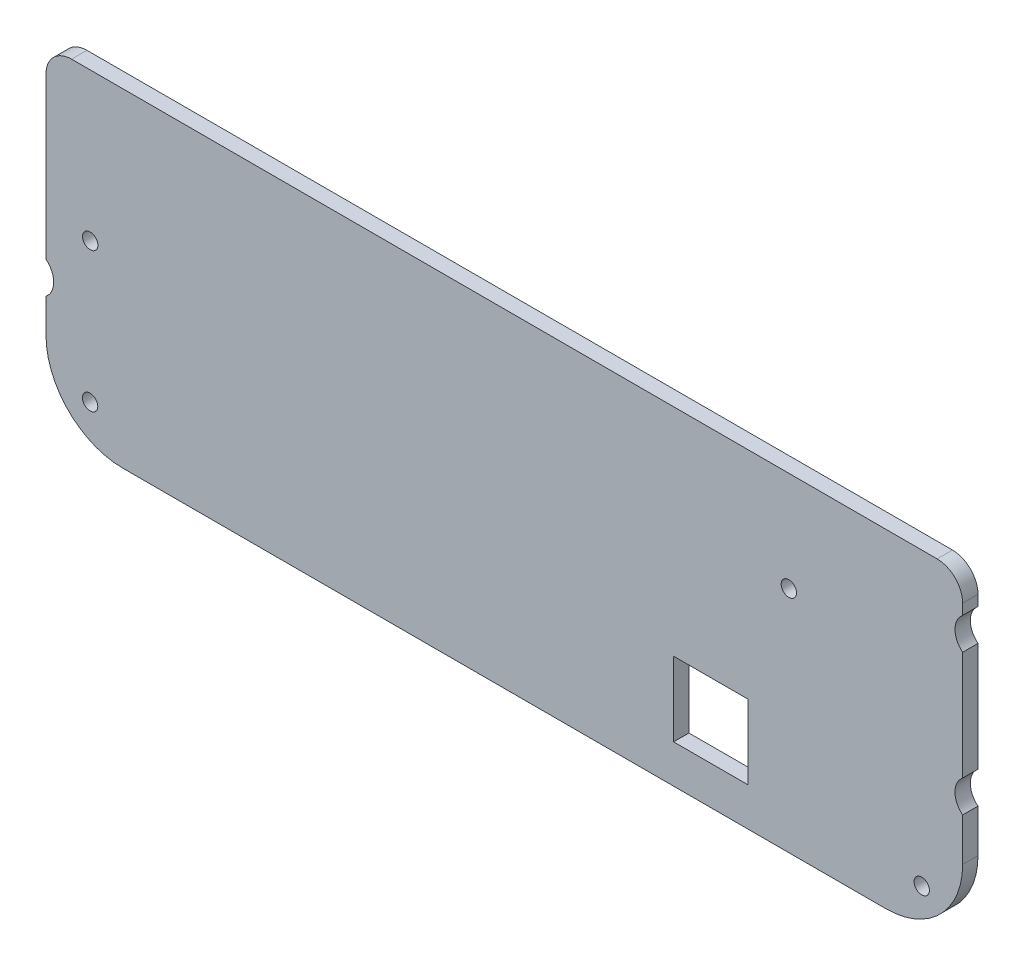
from build123d import *

# Parameters (mm, degrees)
BOSS_EXTRU_1_DEPTH      = 3
ESQUISSE2_R             = 1.5
ENL_V_MAT_EXTRU_1_DEPTH = 10
ESQUISSE7_R             = 4
ENL_V_MAT_EXTRU_2_DEPTH = 10
ESQUISSE8_W             = 14.5
ESQUISSE8_H             = 14.5
ENL_V_MAT_EXTRU_3_DEPTH = 10


with BuildPart() as part:
    # Esquisse1 → Boss.-Extru.1 (new body)
    with BuildSketch(Plane.XY):
        with BuildLine():
            Line((118.101682981, 78.402253408), (267.271682981, 78.402253408))
            ThreePointArc((267.271682981, 78.402253408), (277.878284699, 82.795651691), (282.271682981, 93.402253408))
            Line((282.271682981, 93.402253408), (282.271682981, 137.632253408))
            ThreePointArc((282.271682981, 137.632253408), (280.807216887, 141.167787314), (277.271682981, 142.632253408))
            Line((277.271682981, 142.632253408), (108.101682981, 142.632253408))
            ThreePointArc((108.101682981, 142.632253408), (104.566149075, 141.167787314), (103.101682981, 137.632253408))
            Line((103.101682981, 137.632253408), (103.101682981, 93.402253408))
            ThreePointArc((103.101682981, 93.402253408), (107.495081263, 82.795651691), (118.101682981, 78.402253408))
        make_face()
    extrude(amount=BOSS_EXTRU_1_DEPTH)

    # Esquisse2 → Enlèv. mat.-Extru.1 (cut)
    with BuildSketch(Plane(origin=(0, 0, 0), x_dir=(-1, 0, 0), z_dir=(0, 0, -1))):
        with Locations((-111.741682981, 113.692253408)):
            Circle(ESQUISSE2_R)
        with Locations((-111.721682981, 86.402253408)):
            Circle(ESQUISSE2_R)
        with Locations((-248.301682981, 123.122253408)):
            Circle(ESQUISSE2_R)
        with Locations((-274.271682981, 85.752253408)):
            Circle(ESQUISSE2_R)
    extrude(amount=-ENL_V_MAT_EXTRU_1_DEPTH, mode=Mode.SUBTRACT)

    # Esquisse7 → Enlèv. mat.-Extru.2 (cut)
    with BuildSketch(Plane.XY.offset(3)):
        with Locations((100.601682981, 103.122253408)):
            Circle(ESQUISSE7_R)
        with Locations((284.771682981, 104.902253408)):
            Circle(ESQUISSE7_R)
        with Locations((284.771682981, 132.442253408)):
            Circle(ESQUISSE7_R)
    extrude(amount=-ENL_V_MAT_EXTRU_2_DEPTH, mode=Mode.SUBTRACT)

    # Esquisse8 → Enlèv. mat.-Extru.3 (cut)
    with BuildSketch(Plane(origin=(0, 0, 0), x_dir=(-1, 0, 0), z_dir=(0, 0, -1))):
        with Locations((-233.021682981, 93.152253408)):
            Rectangle(ESQUISSE8_W, ESQUISSE8_H)
    extrude(amount=-ENL_V_MAT_EXTRU_3_DEPTH, mode=Mode.SUBTRACT)


solid = part.part
